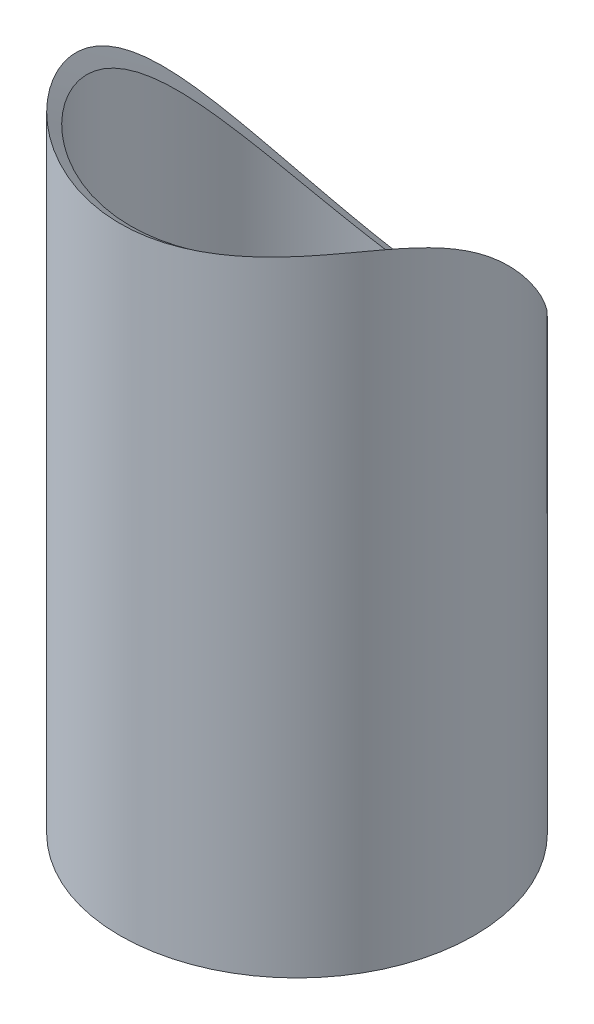
from build123d import *

# Parameters (mm, degrees)
EXTRUDE_1_OUTLINE_R      = 50
EXTRUDE_1_OUTLINE_R_2    = 47
EXTRUDE_1_DEPTH          = 200
CUT_EXTRUDE_1_DEPTH      = 213.132034356
CUT_EXTRUDE_1_DEPTH_BACK = 213.132034356
SKETCH_2_R               = 66


# Read off the part's stored shape, not the designer's step: Вытянуть-Тонкостенный1
with BuildPart() as part:
    # Вытянуть-Тонкостенный1 outline → Вытянуть-Тонкостенный1 (new body)
    with BuildSketch(Plane(origin=(0, 0, 0), x_dir=(1, 0, 0), z_dir=(0, 1, 0))):
        Circle(EXTRUDE_1_OUTLINE_R)
        Circle(EXTRUDE_1_OUTLINE_R_2, mode=Mode.SUBTRACT)
    extrude(amount=EXTRUDE_1_DEPTH)

    # Эскиз2 → Вырез-Вытянуть1 (cut, two sides: drawn at the far end of the back side and taken through both)
    with BuildSketch(Plane(origin=(0, 0, 0), x_dir=(1, 0, 0), z_dir=(0, -0.5735764363510444, -0.819152044288993)).offset(-CUT_EXTRUDE_1_DEPTH_BACK)):
        with Locations((0, -180)):
            Circle(SKETCH_2_R)
    extrude(amount=CUT_EXTRUDE_1_DEPTH + CUT_EXTRUDE_1_DEPTH_BACK, mode=Mode.SUBTRACT)


solid = part.part
